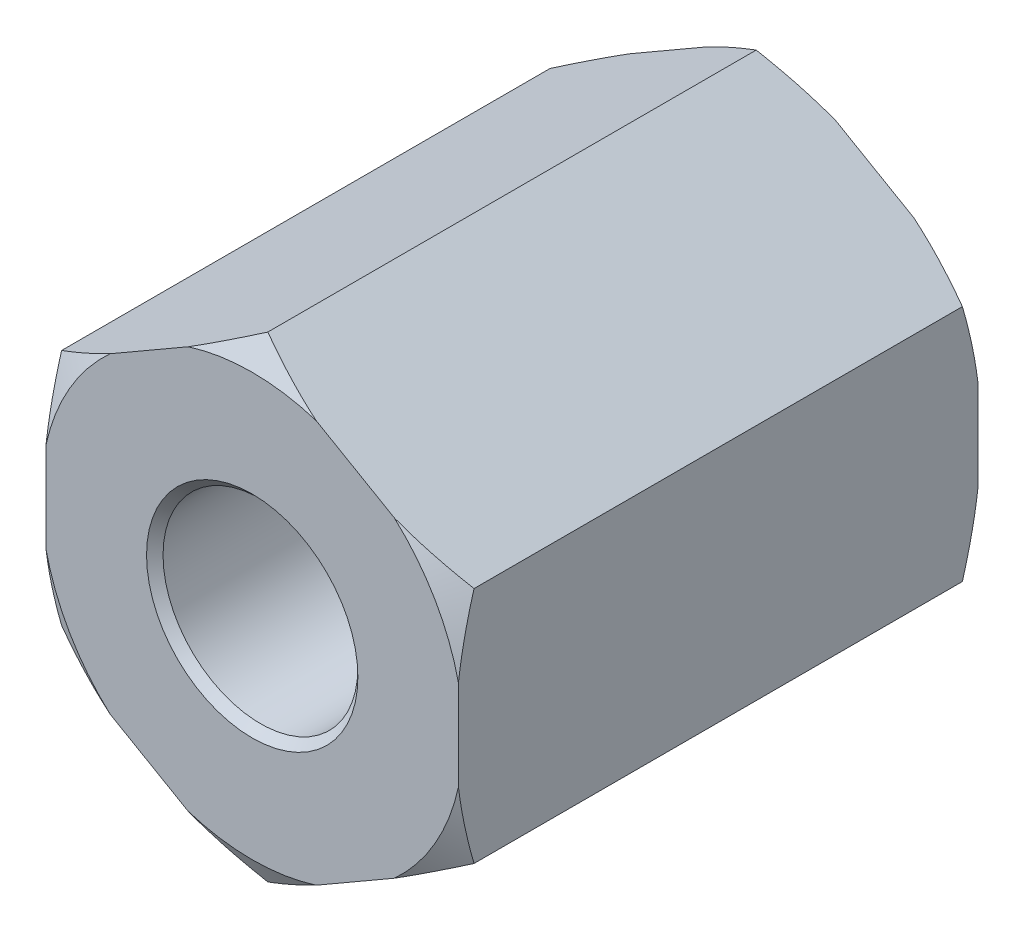
from build123d import *

# Parameters (mm, degrees)
EXTRUDE1_DEPTH     = 16
SKETCH2_OUTSIDE_W  = 88.794
SKETCH2_OUTSIDE_H  = 90.806
SKETCH2_OUTSIDE_R  = 6.5
CUT_EXTRUDE1_DEPTH = 19.83038325
CUT_EXTRUDE1_DRAFT = -60
SKETCH3_OUTSIDE_W  = 88.794
SKETCH3_OUTSIDE_H  = 90.806
SKETCH3_OUTSIDE_R  = 6.5
CUT_EXTRUDE2_DEPTH = 19.83038325
CUT_EXTRUDE2_DRAFT = -60
SKETCH4_R          = 3
CUT_EXTRUDE3_DEPTH = 19.83038325
SKETCH12_R         = 3
SKETCH12_R_2       = 2.350480947
EXTRUDE2_DEPTH     = 16
CUT_SWEEP1_PITCH   = 1
SKETCH13_R         = 3
CUT_EXTRUDE8_DEPTH = 19.830383335
SKETCH14_OUTSIDE_W = 20.1
SKETCH14_OUTSIDE_H = 22.112
CUT_EXTRUDE9_DEPTH = 19.830383335


with BuildPart() as part:
    # Sketch1 → Extrude1 (new body)
    with BuildSketch(Plane.XY):
        Polygon((0, 7.505553499), (-6.5, 3.75277675), (-6.5, -3.75277675), (0, -7.505553499), (6.5, -3.75277675), (6.5, 3.75277675), align=None)
    extrude(amount=-EXTRUDE1_DEPTH)


with BuildPart() as cut_extrude1_tool:
    # Sketch2 outside → Cut-Extrude1 (with draft: the straight prism first)
    with BuildSketch(Plane.XY):
        Rectangle(SKETCH2_OUTSIDE_W, SKETCH2_OUTSIDE_H)
        Circle(SKETCH2_OUTSIDE_R, mode=Mode.SUBTRACT)
    extrude(amount=-CUT_EXTRUDE1_DEPTH)
    # Cut-Extrude1: the draft: its side faces are tilted about the plane it starts from
    cut_extrude1_sides = [cut_extrude1_tool.faces().sort_by_distance(p)[0] for p in [
        (0, -45.403, -9.915191625),
        (44.397, 0, -9.915191625),
        (0, 45.403, -9.915191625),
        (-44.397, 0, -9.915191625),
        (-6.5, 0, -9.915191625),
    ]]
    draft(cut_extrude1_sides, Plane.XY, CUT_EXTRUDE1_DRAFT)


with BuildPart() as part_1:
    add(part.part)

    # Cut-Extrude1: cut by cut_extrude1_tool
    add(cut_extrude1_tool.part, mode=Mode.SUBTRACT)


with BuildPart() as cut_extrude2_tool:
    # Sketch3 outside → Cut-Extrude2 (with draft: the straight prism first)
    with BuildSketch(Plane(origin=(0, 0, -16), x_dir=(-1, 0, 0), z_dir=(0, 0, -1))):
        Rectangle(SKETCH3_OUTSIDE_W, SKETCH3_OUTSIDE_H)
        Circle(SKETCH3_OUTSIDE_R, mode=Mode.SUBTRACT)
    extrude(amount=-CUT_EXTRUDE2_DEPTH)
    # Cut-Extrude2: the draft: its side faces are tilted about the plane it starts from
    cut_extrude2_sides = [cut_extrude2_tool.faces().sort_by_distance(p)[0] for p in [
        (0, -45.403, -6.084808375),
        (-44.397, 0, -6.084808375),
        (0, 45.403, -6.084808375),
        (44.397, 0, -6.084808375),
        (6.5, 0, -6.084808375),
    ]]
    draft(cut_extrude2_sides, Plane(origin=(0, 0, -16), x_dir=(-1, 0, 0), z_dir=(0, 0, -1)), CUT_EXTRUDE2_DRAFT)


with BuildPart() as part_2:
    add(part_1.part)

    # Cut-Extrude2: cut by cut_extrude2_tool
    add(cut_extrude2_tool.part, mode=Mode.SUBTRACT)

    # Sketch4 → Cut-Extrude3 (cut, through all)
    with BuildSketch(Plane.XY):
        Circle(SKETCH4_R)
    extrude(amount=-CUT_EXTRUDE3_DEPTH, mode=Mode.SUBTRACT)

    # Sketch12 → Extrude2 (add)
    with BuildSketch(Plane.XY):
        Circle(SKETCH12_R)
        Circle(SKETCH12_R_2, mode=Mode.SUBTRACT)
    extrude(amount=-EXTRUDE2_DEPTH)

    # Cut-Sweep1: arcs per turn and ends read off the stored shape
    # Cut-Sweep1: the profile of Sketch9 profile screwed along a right-hand helix through 18 turns, 6 arcs to a turn; built about Z, then put on its axis
    cut_sweep1_z = Axis((0, 0, 0), (0, 0, 1))
    cut_sweep1_corners = [(3, 0, -0.5), (3, 0, -0.375), (2.350180947, 0, 0.000173205), (2.350180947, 0, -0.875173205)]
    with BuildLine(mode=Mode.PRIVATE) as cut_sweep1_profile:
        Line(cut_sweep1_corners[0], cut_sweep1_corners[1])
        Line(cut_sweep1_corners[1], cut_sweep1_corners[2])
        Line(cut_sweep1_corners[2], cut_sweep1_corners[3])
        Line(cut_sweep1_corners[3], cut_sweep1_corners[0])
    cut_sweep1_cap = Face(cut_sweep1_profile.wire())
    cut_sweep1_turn_angles = [0, 30, 60, 90, 120, 150, 180, 210, 240, 270, 300, 330, 360]
    cut_sweep1_turn_weights = [1, 0.8660254037844387, 1, 0.8660254037844387, 1, 0.8660254037844387, 1, 0.8660254037844387, 1, 0.8660254037844387, 1, 0.8660254037844387, 1]
    cut_sweep1_turn_rails = [Edge.make_bspline([Vector(p[0], p[1], 0).rotate(cut_sweep1_z, cut_sweep1_turn_angles[k]) / cut_sweep1_turn_weights[k] + Vector(0, 0, p[2] + CUT_SWEEP1_PITCH * cut_sweep1_turn_angles[k] / 360) for k in range(13)], [0, 0, 0, 1, 1, 2, 2, 3, 3, 4, 4, 5, 5, 6, 6, 6], 2, cut_sweep1_turn_weights) for p in cut_sweep1_corners]
    cut_sweep1_turn_sides = [Face.make_surface_from_curves(cut_sweep1_turn_rails[p[0]], cut_sweep1_turn_rails[p[1]]) for p in [(0, 1), (1, 2), (2, 3), (3, 0)]]
    cut_sweep1 = Plane(origin=(0, 0, 0), x_dir=(0, 1, 0), z_dir=(0, 0, -1)) * Solid(Shell([*[p.moved(Location((0, 0, CUT_SWEEP1_PITCH * i))) for i in range(18) for p in cut_sweep1_turn_sides], cut_sweep1_cap, cut_sweep1_cap.rotate(cut_sweep1_z, 6480).moved(Location((0, 0, CUT_SWEEP1_PITCH * 6480 / 360)))]))
    add(cut_sweep1, mode=Mode.SUBTRACT)

    # Cut-Extrude6 cone 1 section (through the dimple's axis) → Cut-Extrude6 (revolve, cut)
    with BuildSketch(Plane(origin=(0, 0, 0), x_dir=(0, -1, 0), z_dir=(1, 0, 0))):
        Polygon((0, 0), (3.254, 0), (0, 3.254), align=None)
    revolve(axis=Axis((0, 0, 0), (0, 0, -1)), mode=Mode.SUBTRACT)

    # Cut-Extrude7 cone 1 section (through the dimple's axis) → Cut-Extrude7 (revolve, cut)
    with BuildSketch(Plane(origin=(0, 0, -16), x_dir=(0, 1, 0), z_dir=(1, 0, 0))):
        Polygon((0, 0), (3.254, 0), (0, 3.254), align=None)
    revolve(axis=Axis((0, 0, -16), (0, 0, 1)), mode=Mode.SUBTRACT)

    # Sketch13 → Cut-Extrude8 (cut, through all)
    with BuildSketch(Plane.XY):
        with Locations(Location((0, 0, 0), (0, 0, 180))):
            Circle(SKETCH13_R)
    extrude(amount=-CUT_EXTRUDE8_DEPTH, mode=Mode.SUBTRACT)

    # Sketch14 outside → Cut-Extrude9 (cut, through all)
    with BuildSketch(Plane.XY):
        Rectangle(SKETCH14_OUTSIDE_W, SKETCH14_OUTSIDE_H)
        Polygon((0, 7.332348419), (-6.35, 3.666174209), (-6.35, -3.666174209), (0, -7.332348419), (6.35, -3.666174209), (6.35, 3.666174209), align=None, mode=Mode.SUBTRACT)
    extrude(amount=-CUT_EXTRUDE9_DEPTH, mode=Mode.SUBTRACT)


solid = part_2.part
